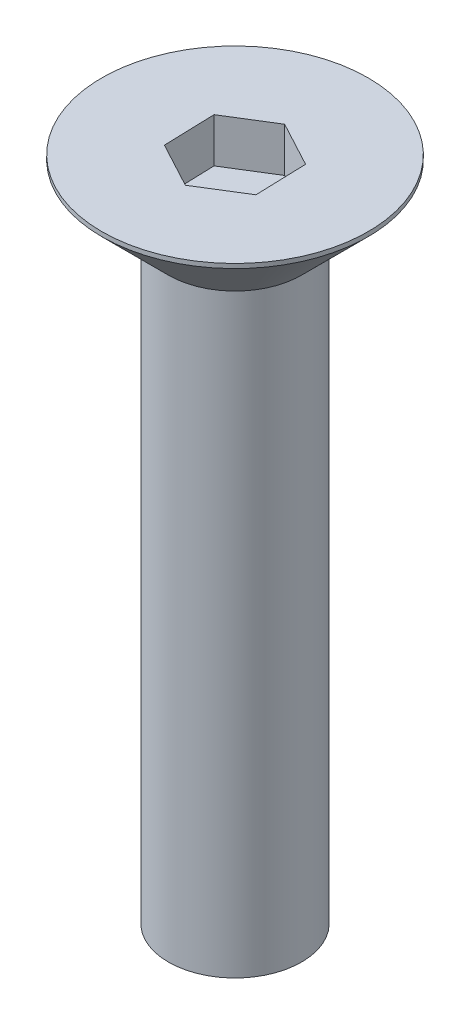
from build123d import *

# Parameters (mm, degrees)
SKETCH_1_R          = 1.5
EXTRUDE_1_DEPTH     = 12
SKETCH_2_R          = 3
EXTRUDE_2_DEPTH     = 3
CHAMFER_1_SIZE      = 2.9
CUT_EXTRUDE_1_DEPTH = 1


with BuildPart() as part:
    # 草图1 → 凸台-拉伸1 (new body)
    with BuildSketch(Plane(origin=(0, 0, 0), x_dir=(1, 0, 0), z_dir=(0, 1, 0))):
        with Locations(Location((0, 0, 0), (0, 0, 270))):
            Circle(SKETCH_1_R)
    extrude(amount=EXTRUDE_1_DEPTH)

    # 草图2 → 凸台-拉伸2 (add)
    with BuildSketch(Plane(origin=(0, 12, 0), x_dir=(1, 0, 0), z_dir=(0, 1, 0))):
        with Locations(Location((0, 0, 0), (0, 0, 270))):
            Circle(SKETCH_2_R)
    extrude(amount=EXTRUDE_2_DEPTH)

    # 倒角1
    # the kernel refuses this chamfer: 2.9 mm, written as the material it takes off along each edge
    with BuildSketch(Plane(origin=(0, 12, 0), x_dir=(0, 0, 1), z_dir=(-1, 0, 0))) as chamfer_1_piece_1_section:
        Polygon((3, CHAMFER_1_SIZE), (3 - CHAMFER_1_SIZE, 0), (3, 0), align=None)
    chamfer_1_piece_1 = revolve(axis=Axis((0, 12, 0), (0, 1, 0)), mode=Mode.PRIVATE)
    chamfer_1_piece_1 = chamfer_1_piece_1 - Plane(origin=(0, 14.16453564, 0), x_dir=(0, 0, 1), z_dir=(0, -1, 0)) * Cylinder(1.5, 12, mode=Mode.PRIVATE)
    add(chamfer_1_piece_1, mode=Mode.SUBTRACT)

    # 草图3 → 切除-拉伸1 (cut)
    with BuildSketch(Plane(origin=(0, 15, 0), x_dir=(1, 0, 0), z_dir=(0, 1, 0))):
        Polygon((1.017530084, -0.545862493), (0.981495828, 0.608275655), (-0.036034256, 1.154138148), (-1.017530084, 0.545862493), (-0.981495828, -0.608275655), (0.036034256, -1.154138148), align=None)
    extrude(amount=-CUT_EXTRUDE_1_DEPTH, mode=Mode.SUBTRACT)


solid = part.part
